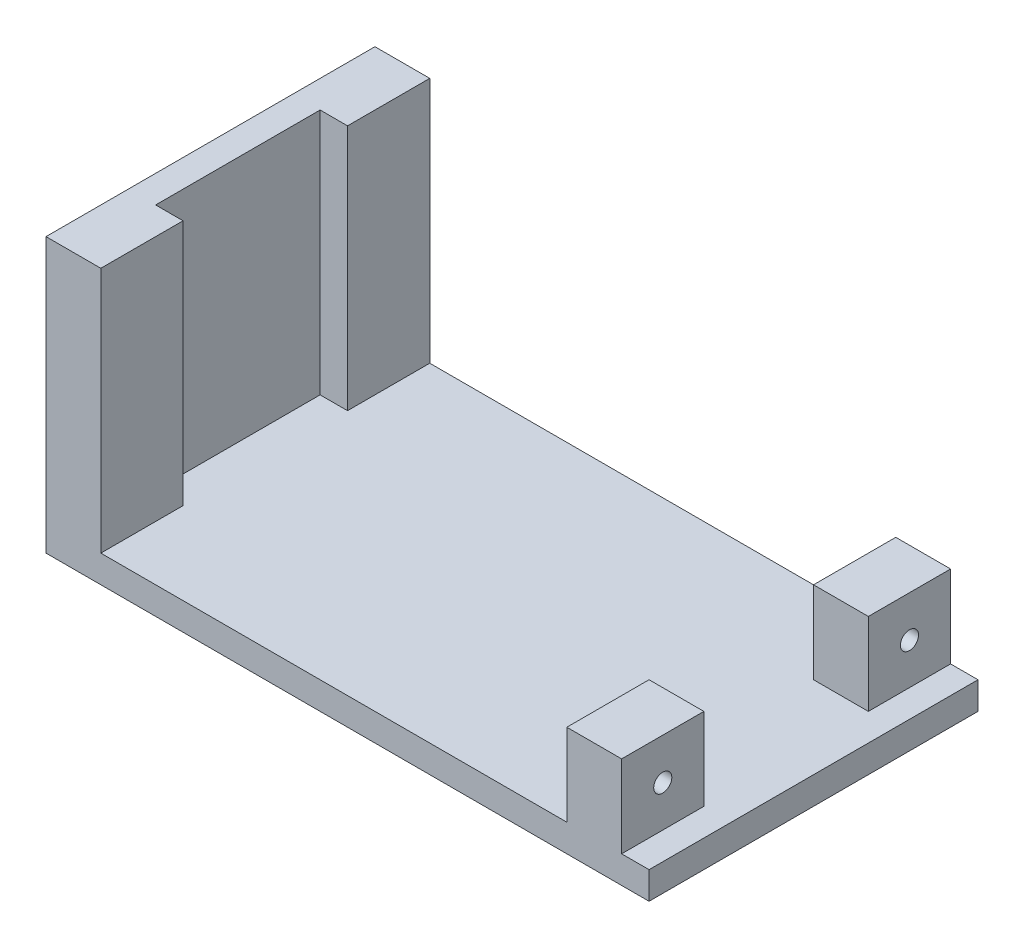
from build123d import *

# Parameters (mm, degrees)
CROQUIS1_W                = 110
CROQUIS1_H                = 60
SALIENTE_EXTRUIR1_DEPTH   = 5
SALIENTE_EXTRUIR2_DEPTH   = 45
CROQUIS4_W                = 15
CROQUIS4_H                = 15
SALIENTE_EXTRUIR3_DEPTH   = 15
CROQUIS5_W                = 15
CROQUIS5_H                = 15
CORTAR_EXTRUIR1_DEPTH     = 5
TALADRO_ROSCADO_M41_D     = 3.3
TALADRO_ROSCADO_M41_DEPTH = 14.008579979
TALADRO_ROSCADO_M41_TIP   = 0.991420021


with BuildPart() as part:
    # Croquis1 → Saliente-Extruir1 (new body)
    with BuildSketch(Plane(origin=(0, 0, 0), x_dir=(1, 0, 0), z_dir=(0, 1, 0))):
        with Locations((55, 30)):
            Rectangle(CROQUIS1_W, CROQUIS1_H)
    extrude(amount=SALIENTE_EXTRUIR1_DEPTH)

    # Croquis2 → Saliente-Extruir2 (add)
    with BuildSketch(Plane(origin=(0, 5, 0), x_dir=(1, 0, 0), z_dir=(0, 1, 0))):
        Polygon((0, 0), (10, 0), (10, 15), (5, 15), (5, 45), (10, 45), (10, 60), (0, 60), align=None)
    extrude(amount=SALIENTE_EXTRUIR2_DEPTH)

    # Croquis4 → Saliente-Extruir3 (add)
    with BuildSketch(Plane(origin=(0, 5, 0), x_dir=(1, 0, 0), z_dir=(0, 1, 0))):
        with Locations((102.5, 52.5)):
            Rectangle(CROQUIS4_W, CROQUIS4_H)
        with Locations((102.5, 7.5)):
            Rectangle(CROQUIS4_W, CROQUIS4_H)
    extrude(amount=SALIENTE_EXTRUIR3_DEPTH)

    # Croquis5 → Cortar-Extruir1 (cut)
    with BuildSketch(Plane(origin=(110, 0, 0), x_dir=(0, 0, -1), z_dir=(1, 0, 0))):
        with Locations((7.5, 12.5)):
            Rectangle(CROQUIS5_W, CROQUIS5_H)
        with Locations((52.5, 12.5)):
            Rectangle(CROQUIS5_W, CROQUIS5_H)
    extrude(amount=-CORTAR_EXTRUIR1_DEPTH, mode=Mode.SUBTRACT)

    # Taladro roscado M41
    with Locations(Plane(origin=(105, 0, 0), x_dir=(0, 0, -1), z_dir=(1, 0, 0))):
        with Locations((7.5, 12.5), (52.5, 12.5)):
            Hole(TALADRO_ROSCADO_M41_D / 2, depth=TALADRO_ROSCADO_M41_DEPTH)
            with Locations((0, 0, -(TALADRO_ROSCADO_M41_DEPTH + TALADRO_ROSCADO_M41_TIP / 2))):  # 118° drill point
                Cone(0, TALADRO_ROSCADO_M41_D / 2, TALADRO_ROSCADO_M41_TIP, mode=Mode.SUBTRACT)


solid = part.part
